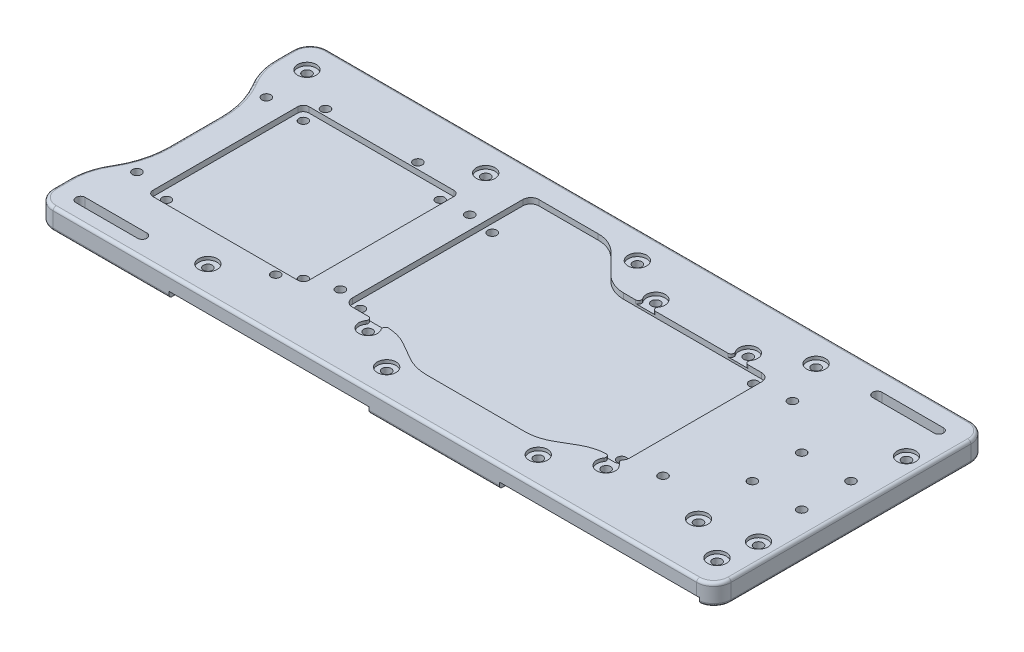
from build123d import *

# Parameters (mm, degrees)
SKETCH_1_W           = 210
SKETCH_1_H           = 89
EXTRUDE_1_DEPTH      = 6.8
SKETCH_9_W           = 89
SKETCH_9_H           = 6.8
EXTRUDE_2_DEPTH      = 5
SKETCH_10_W          = 89
SKETCH_10_H          = 6.8
EXTRUDE_3_DEPTH      = 5
CUT_EXTRUDE_4_DEPTH  = 119.854911552
FILLET_1_R           = 20
FILLET_2_R           = 28
FILLET_3_R           = 5.6
SKETCH_13_W          = 50.6
SKETCH_13_H          = 50.6
CUT_EXTRUDE_5_DEPTH  = 1.8
FILLET_4_R           = 1.8
SKETCH_14_R          = 1.425
CUT_EXTRUDE_6_DEPTH  = 3
SKETCH_15_W          = 90
SKETCH_15_H          = 48
CUT_EXTRUDE_7_DEPTH  = 1.8
FILLET_5_R           = 2.6
SKETCH_16_R          = 1.45
CUT_EXTRUDE_8_DEPTH  = 3
SKETCH_18_R          = 1.45
CUT_EXTRUDE_9_DEPTH  = 119.854911552
SKETCH_19_R          = 3.025
CUT_EXTRUDE_10_DEPTH = 1.04
FILLET_6_R           = 1
CUT_EXTRUDE_12_DEPTH = 1.8
FILLET_7_R           = 2.6
FILLET_8_R           = 10
FILLET_9_R           = 15
SKETCH_23_R          = 1.45
CUT_EXTRUDE_14_DEPTH = 6.8
SKETCH_26_R          = 1.45
CUT_EXTRUDE_15_DEPTH = 6.8
CUT_EXTRUDE_16_DEPTH = 2
SKETCH_28_R          = 3.025
CUT_EXTRUDE_17_DEPTH = 1.04
FILLET_10_R          = 1
CUT_EXTRUDE_20_DEPTH = 1.04
FILLET_11_R          = 1
CUT_EXTRUDE_START    = -2
CUT_EXTRUDE_21_DEPTH = 2


# Read off the part's stored shape, not the designer's step: 切除-拉伸21
with BuildPart() as part:
    # 草图1 → 凸台-拉伸1 (new body)
    with BuildSketch(Plane(origin=(0, 0, 0), x_dir=(1, 0, 0), z_dir=(0, 1, 0))):
        Rectangle(SKETCH_1_W, SKETCH_1_H)
    extrude(amount=EXTRUDE_1_DEPTH)

    # 草图9 → 凸台-拉伸2 (add)
    with BuildSketch(Plane.ZY.offset(105)):
        with Locations((0, 3.4)):
            Rectangle(SKETCH_9_W, SKETCH_9_H)
    extrude(amount=EXTRUDE_2_DEPTH)

    # 草图10 → 凸台-拉伸3 (add)
    with BuildSketch(Plane(origin=(105, 0, 0), x_dir=(0, 0, -1), z_dir=(1, 0, 0))):
        with Locations((0, 3.4)):
            Rectangle(SKETCH_10_W, SKETCH_10_H)
    extrude(amount=EXTRUDE_3_DEPTH)

    # 草图11 → 切除-拉伸4 (cut, through all)
    with BuildSketch(Plane(origin=(0, 6.8, 0), x_dir=(1, 0, 0), z_dir=(0, 1, 0))):
        Polygon((-110, 0), (-110, 28), (-103, 15.875644347), (-103, -15.875644347), (-110, -28), align=None)
    extrude(amount=-CUT_EXTRUDE_4_DEPTH, mode=Mode.SUBTRACT)

    # 圆角1
    fillet_1_edges = [part.edges().sort_by_distance(p)[0] for p in [
        (-110, 3.4, 28),
        (-110, 3.4, -28),
    ]]
    fillet(fillet_1_edges, radius=FILLET_1_R)

    # 圆角2
    fillet_2_edges = [part.edges().sort_by_distance(p)[0] for p in [
        (-103, 3.4, -15.875644347),
        (-103, 3.4, 15.875644347),
    ]]
    fillet(fillet_2_edges, radius=FILLET_2_R)

    # 圆角3
    fillet_3_edges = [part.edges().sort_by_distance(p)[0] for p in [
        (-110, 3.4, -44.5),
        (-110, 3.4, 44.5),
        (110, 3.4, 44.5),
        (110, 3.4, -44.5),
    ]]
    fillet(fillet_3_edges, radius=FILLET_3_R)

    # 草图13 → 切除-拉伸5 (cut)
    with BuildSketch(Plane(origin=(0, 6.8, 0), x_dir=(1, 0, 0), z_dir=(0, 1, 0))):
        with Locations((-67.7, 0)):
            Rectangle(SKETCH_13_W, SKETCH_13_H)
    extrude(amount=-CUT_EXTRUDE_5_DEPTH, mode=Mode.SUBTRACT)

    # 圆角4
    fillet_4_edges = [part.edges().sort_by_distance(p)[0] for p in [
        (-42.4, 5.9, -25.3),
        (-42.4, 5.9, 25.3),
        (-93, 5.9, 25.3),
        (-93, 5.9, -25.3),
    ]]
    fillet(fillet_4_edges, radius=FILLET_4_R)

    # 草图14 → 切除-拉伸6 (cut)
    with BuildSketch(Plane(origin=(0, 5, 0), x_dir=(1, 0, 0), z_dir=(0, 1, 0))):
        with Locations(Location((-89.9, 22.2, 0), (0, 0, 270))):
            Circle(SKETCH_14_R)
        with Locations(Location((-45.5, 22.2, 0), (0, 0, 90))):
            Circle(SKETCH_14_R)
        with Locations(Location((-45.5, -22.2, 0), (0, 0, 270))):
            Circle(SKETCH_14_R)
        with Locations(Location((-89.9, -22.2, 0), (0, 0, 90))):
            Circle(SKETCH_14_R)
    extrude(amount=-CUT_EXTRUDE_6_DEPTH, mode=Mode.SUBTRACT)

    # 草图15 → 切除-拉伸7 (cut)
    with BuildSketch(Plane(origin=(0, 6.8, 0), x_dir=(1, 0, 0), z_dir=(0, 1, 0))):
        with Locations((14.6, 0)):
            Rectangle(SKETCH_15_W, SKETCH_15_H)
    extrude(amount=-CUT_EXTRUDE_7_DEPTH, mode=Mode.SUBTRACT)

    # 圆角5
    fillet_5_edges = [part.edges().sort_by_distance(p)[0] for p in [
        (59.6, 5.9, -24),
        (59.6, 5.9, 24),
        (-30.4, 5.9, 24),
        (-30.4, 5.9, -24),
    ]]
    fillet(fillet_5_edges, radius=FILLET_5_R)

    # 草图16 → 切除-拉伸8 (cut)
    with BuildSketch(Plane(origin=(0, 5, 0), x_dir=(1, 0, 0), z_dir=(0, 1, 0))):
        with Locations(Location((-27.8, -21.4, 0), (0, 0, 270))):
            Circle(SKETCH_16_R)
        with Locations(Location((-27.8, 21.4, 0), (0, 0, 90))):
            Circle(SKETCH_16_R)
        with Locations(Location((57, -21.4, 0), (0, 0, 90))):
            Circle(SKETCH_16_R)
        with Locations(Location((57, 21.4, 0), (0, 0, 270))):
            Circle(SKETCH_16_R)
    extrude(amount=-CUT_EXTRUDE_8_DEPTH, mode=Mode.SUBTRACT)

    # 草图18 → 切除-拉伸9 (cut, through all)
    with BuildSketch(Plane(origin=(0, 6.8, 0), x_dir=(1, 0, 0), z_dir=(0, 1, 0))):
        with Locations(Location((102, 8, 0), (0, 0, 270))):
            Circle(SKETCH_18_R)
        with Locations(Location((86, 8, 0), (0, 0, 270))):
            Circle(SKETCH_18_R)
        with Locations(Location((70, 21, 0), (0, 0, 270))):
            Circle(SKETCH_18_R)
        with Locations(Location((102, -8, 0), (0, 0, 90))):
            Circle(SKETCH_18_R)
        with Locations(Location((86, -8, 0), (0, 0, 90))):
            Circle(SKETCH_18_R)
        with Locations(Location((70, -21, 0), (0, 0, 90))):
            Circle(SKETCH_18_R)
        with Locations(Location((104, 24, 0), (0, 0, 270))):
            Circle(SKETCH_18_R)
        with Locations(Location((104, -24, 0), (0, 0, 90))):
            Circle(SKETCH_18_R)
        with BuildLine():
            Line((102, 35), (82, 35))
            ThreePointArc((82, 35), (80.5, 36.5), (82, 38))
            Line((82, 38), (102, 38))
            ThreePointArc((102, 38), (103.5, 36.5), (102, 35))
        make_face()
        with BuildLine():
            Line((-102, -36.5), (-82, -36.5))
            ThreePointArc((-82, -36.5), (-80.5, -38), (-82, -39.5))
            Line((-82, -39.5), (-102, -39.5))
            ThreePointArc((-102, -39.5), (-103.5, -38), (-102, -36.5))
        make_face()
    extrude(amount=-CUT_EXTRUDE_9_DEPTH, mode=Mode.SUBTRACT)

    # 草图19 → 切除-拉伸10 (cut)
    with BuildSketch(Plane(origin=(0, 6.8, 0), x_dir=(1, 0, 0), z_dir=(0, 1, 0))):
        with Locations(Location((104, 24, 0), (0, 0, 270))):
            Circle(SKETCH_19_R)
        with Locations(Location((104, -24, 0), (0, 0, 270))):
            Circle(SKETCH_19_R)
    extrude(amount=-CUT_EXTRUDE_10_DEPTH, mode=Mode.SUBTRACT)

    # 圆角6
    fillet_6_edges = [part.edges().sort_by_distance(p)[0] for p in [
        (-107.035898385, 0, 22.866025404),
        (-110, 0, 36.129491924),
        (-109.318516526, 0, -28.182602947),
        (-109.318516526, 0, 28.182602947),
        (-103, 0, 0),
        (-107.035898385, 0, -22.866025404),
        (-103.954076864, 0, 15.620000222),
        (-103.954076864, 0, -15.620000222),
        (110, 0, 0),
        (0, 0, -44.5),
        (-110, 0, -36.129491924),
        (0, 0, 44.5),
        (-108.359797975, 0, 42.859797975),
        (-108.359797975, 0, -42.859797975),
        (108.359797975, 0, 42.859797975),
        (108.359797975, 0, -42.859797975),
    ]]
    fillet(fillet_6_edges, radius=FILLET_6_R)

    # 草图21 → 切除-拉伸12 (cut)
    with BuildSketch(Plane(origin=(0, 6.8, 0), x_dir=(1, 0, 0), z_dir=(0, 1, 0))):
        Polygon((-30.4, 21.4), (-30.4, 36.5), (-4.4, 36.5), (8.1, 24), (8.1, 21.4), align=None)
        Polygon((-12.75, -24), (-0.625644347, -31), (39.125644347, -31), (51.25, -24), align=None)
    extrude(amount=-CUT_EXTRUDE_12_DEPTH, mode=Mode.SUBTRACT)

    # 圆角7
    fillet_7_edges = [part.edges().sort_by_distance(p)[0] for p in [
        (-30.4, 5.9, -36.5),
    ]]
    fillet(fillet_7_edges, radius=FILLET_7_R)

    # 圆角8
    fillet_8_edges = [part.edges().sort_by_distance(p)[0] for p in [
        (-4.4, 5.9, -36.5),
        (8.1, 5.9, -24),
    ]]
    fillet(fillet_8_edges, radius=FILLET_8_R)

    # 圆角9
    fillet_9_edges = [part.edges().sort_by_distance(p)[0] for p in [
        (-12.75, 5.9, 24),
        (51.25, 5.9, 24),
        (39.125644347, 5.9, 31),
        (-0.625644347, 5.9, 31),
    ]]
    fillet(fillet_9_edges, radius=FILLET_9_R)

    # 草图23 → 切除-拉伸14 (cut)
    with BuildSketch(Plane(origin=(0, 6.8, 0), x_dir=(1, 0, 0), z_dir=(0, 1, 0))):
        with Locations(Location((-100.7, 21, 0), (0, 0, 270))):
            Circle(SKETCH_23_R)
        with Locations(Location((-34.7, 21, 0), (0, 0, 90))):
            Circle(SKETCH_23_R)
        with Locations(Location((-34.7, -21, 0), (0, 0, 270))):
            Circle(SKETCH_23_R)
        with Locations(Location((-100.7, -21, 0), (0, 0, 90))):
            Circle(SKETCH_23_R)
    extrude(amount=-CUT_EXTRUDE_14_DEPTH, mode=Mode.SUBTRACT)

    # 草图26 → 切除-拉伸15 (cut)
    with BuildSketch(Plane.XZ):
        with Locations(Location((-101.85, -35.322234231, 0), (0, 0, 270))):
            Circle(SKETCH_26_R)
        with Locations(Location((-87.85, -27.322234231, 0), (0, 0, 270))):
            Circle(SKETCH_26_R)
        with Locations(Location((-57.85, -27.322234231, 0), (0, 0, 270))):
            Circle(SKETCH_26_R)
        with Locations(Location((-43.85, -35.322234231, 0), (0, 0, 270))):
            Circle(SKETCH_26_R)
        with Locations(Location((5.35, -35.322234231, 0), (0, 0, 270))):
            Circle(SKETCH_26_R)
        with Locations(Location((19.35, -27.322234231, 0), (0, 0, 270))):
            Circle(SKETCH_26_R)
        with Locations(Location((49.35, -27.322234231, 0), (0, 0, 270))):
            Circle(SKETCH_26_R)
        with Locations(Location((63.35, -35.322234231, 0), (0, 0, 270))):
            Circle(SKETCH_26_R)
        with Locations(Location((101.85, 35.322234231, 0), (0, 0, 270))):
            Circle(SKETCH_26_R)
        with Locations(Location((87.85, 27.322234231, 0), (0, 0, 270))):
            Circle(SKETCH_26_R)
        with Locations(Location((57.85, 27.322234231, 0), (0, 0, 270))):
            Circle(SKETCH_26_R)
        with Locations(Location((43.85, 35.322234231, 0), (0, 0, 270))):
            Circle(SKETCH_26_R)
        with Locations(Location((-5.35, 35.322234231, 0), (0, 0, 270))):
            Circle(SKETCH_26_R)
        with Locations(Location((-19.35, 27.322234231, 0), (0, 0, 270))):
            Circle(SKETCH_26_R)
        with Locations(Location((-49.35, 27.322234231, 0), (0, 0, 270))):
            Circle(SKETCH_26_R)
        with Locations(Location((-63.35, 35.322234231, 0), (0, 0, 270))):
            Circle(SKETCH_26_R)
    extrude(amount=-CUT_EXTRUDE_15_DEPTH, mode=Mode.SUBTRACT)

    # 草图27 → 切除-拉伸16 (cut)
    with BuildSketch(Plane.XZ):
        with BuildLine():
            Line((-66.5, 44.5), (-66.5, 35.822234231))
            ThreePointArc((-66.5, 35.822234231), (-62.985281374, 27.336952857), (-54.5, 23.822234231))
            Line((-54.5, 23.822234231), (-14.2, 23.822234231))
            ThreePointArc((-14.2, 23.822234231), (-5.714718626, 27.336952857), (-2.2, 35.822234231))
            Line((-2.2, 35.822234231), (-2.20241857, 44.5))
            Line((-2.20241857, 44.5), (-66.5, 44.5))
        make_face()
        with BuildLine():
            Line((40.7, 44.5), (105, 44.5))
            Line((105, 44.5), (105, 35.822234231))
            ThreePointArc((105, 35.822234231), (101.485281374, 27.336952857), (93, 23.822234231))
            Line((93, 23.822234231), (52.7, 23.822234231))
            ThreePointArc((52.7, 23.822234231), (44.214718626, 27.336952857), (40.7, 35.822234231))
            Line((40.7, 35.822234231), (40.7, 44.5))
        make_face()
        with BuildLine():
            Line((66.5, -44.5), (66.5, -35.822234231))
            ThreePointArc((66.5, -35.822234231), (62.985281374, -27.336952857), (54.5, -23.822234231))
            Line((54.5, -23.822234231), (14.2, -23.822234231))
            ThreePointArc((14.2, -23.822234231), (5.714718626, -27.336952857), (2.2, -35.822234231))
            Line((2.2, -35.822234231), (2.202418571, -44.5))
            Line((2.202418571, -44.5), (66.5, -44.5))
        make_face()
        with BuildLine():
            Line((-105, -35.822234231), (-104.997581429, -44.5))
            Line((-104.997581429, -44.5), (-40.7, -44.5))
            Line((-40.7, -44.5), (-40.7, -35.822234231))
            ThreePointArc((-40.7, -35.822234231), (-44.214718626, -27.336952857), (-52.7, -23.822234231))
            Line((-52.7, -23.822234231), (-93, -23.822234231))
            ThreePointArc((-93, -23.822234231), (-101.485281374, -27.336952857), (-105, -35.822234231))
        make_face()
    extrude(amount=-CUT_EXTRUDE_16_DEPTH, mode=Mode.SUBTRACT)

    # 草图28 → 切除-拉伸17 (cut)
    with BuildSketch(Plane(origin=(0, 6.8, 0), x_dir=(1, 0, 0), z_dir=(0, 1, 0))):
        with Locations(Location((-63.35, -35.322234231, 0), (0, 0, 270))):
            Circle(SKETCH_28_R)
        with Locations(Location((-19.35, -27.322234231, 0), (0, 0, 270))):
            Circle(SKETCH_28_R)
        with Locations(Location((-5.35, -35.322234231, 0), (0, 0, 270))):
            Circle(SKETCH_28_R)
        with Locations(Location((43.85, -35.322234231, 0), (0, 0, 270))):
            Circle(SKETCH_28_R)
        with Locations(Location((57.85, -27.322234231, 0), (0, 0, 270))):
            Circle(SKETCH_28_R)
        with Locations(Location((87.85, -27.322234231, 0), (0, 0, 270))):
            Circle(SKETCH_28_R)
        with Locations(Location((101.85, -35.322234231, 0), (0, 0, 270))):
            Circle(SKETCH_28_R)
        with Locations(Location((63.35, 35.322234231, 0), (0, 0, 270))):
            Circle(SKETCH_28_R)
        with Locations(Location((49.35, 27.322234231, 0), (0, 0, 270))):
            Circle(SKETCH_28_R)
        with Locations(Location((19.35, 27.322234231, 0), (0, 0, 270))):
            Circle(SKETCH_28_R)
        with Locations(Location((5.35, 35.322234231, 0), (0, 0, 270))):
            Circle(SKETCH_28_R)
        with Locations(Location((-43.85, 35.322234231, 0), (0, 0, 270))):
            Circle(SKETCH_28_R)
        with Locations(Location((-101.85, 35.322234231, 0), (0, 0, 270))):
            Circle(SKETCH_28_R)
    extrude(amount=-CUT_EXTRUDE_17_DEPTH, mode=Mode.SUBTRACT)

    # 圆角10
    fillet_10_edges = [part.edges().sort_by_distance(p)[0] for p in [
        (-107.035898385, 6.8, 22.866025404),
        (-110, 6.8, -36.129491924),
        (-109.318516526, 6.8, -28.182602947),
        (-109.318516526, 6.8, 28.182602947),
        (-103, 6.8, 0),
        (-107.035898385, 6.8, -22.866025404),
        (-103.954076864, 6.8, 15.620000222),
        (-103.954076864, 6.8, -15.620000222),
        (110, 6.8, 0),
        (-110, 6.8, 36.129491924),
        (0, 6.8, 44.5),
        (0, 6.8, -44.5),
        (-108.359797975, 6.8, 42.859797975),
        (-108.359797975, 6.8, -42.859797975),
        (108.359797975, 6.8, 42.859797975),
        (108.359797975, 6.8, -42.859797975),
    ]]
    fillet(fillet_10_edges, radius=FILLET_10_R)

    # 草图32 → 切除-拉伸20 (cut)
    with BuildSketch(Plane(origin=(0, 6.8, 0), x_dir=(1, 0, 0), z_dir=(0, 1, 0))):
        with BuildLine():
            Line((-21.488998013, -25.183236218), (-20.305761795, -24))
            Line((-20.305761795, -24), (-18.394238205, -24))
            Line((-18.394238205, -24), (-17.211001987, -25.183236218))
            ThreePointArc((-17.211001987, -25.183236218), (-19.35, -30.347234231), (-21.488998013, -25.183236218))
        make_face()
        with BuildLine():
            Line((55.711001987, -25.183236218), (57.1721109, -23.722127305))
            Line((57.1721109, -23.722127305), (57.843769498, -23.038007703))
            Line((57.843769498, -23.038007703), (59.988998013, -25.183236218))
            ThreePointArc((59.988998013, -25.183236218), (57.85, -30.347234231), (55.711001987, -25.183236218))
        make_face()
        with BuildLine():
            Line((47.211001987, 25.183236218), (48.686058032, 23.708180173))
            Line((48.686058032, 23.708180173), (49.976374788, 23.670612993))
            Line((49.976374788, 23.670612993), (51.488998013, 25.183236218))
            ThreePointArc((51.488998013, 25.183236218), (49.35, 30.347234231), (47.211001987, 25.183236218))
        make_face()
        with BuildLine():
            Line((17.211001987, 25.183236218), (18.394238205, 24))
            Line((18.394238205, 24), (20.305761795, 24))
            Line((20.305761795, 24), (21.488998013, 25.183236218))
            ThreePointArc((21.488998013, 25.183236218), (19.35, 30.347234231), (17.211001987, 25.183236218))
        make_face()
    extrude(amount=-CUT_EXTRUDE_20_DEPTH, mode=Mode.SUBTRACT)

    # 圆角11
    # the kernel refuses this fillet: 1 mm, written as the material it takes off along each edge
    with BuildSketch(Plane(origin=(18.394238205, 12.629420389, -24), x_dir=(-0.6927973692834478, 0, -0.7211323076342745), z_dir=(0, -1, 0)), Plane(origin=(50.305761795, 5.76, -24), x_dir=(0.6927973692834356, 0, -0.7211323076342864), z_dir=(0, 1, 0)), Plane(origin=(48.394238205, 12.629420389, -24), x_dir=(-0.6927973692834373, 0, -0.7211323076342848), z_dir=(0, -1, 0))) as fillet_11_piece_1:
        with BuildLine():
            CenterArc((2.336575152, -0.988715982), FILLET_11_R, 98.615465609, 125.236489242)
            Line((1.615442844, -1.681513351), (1.543329613, -1.750793088))
            Line((1.543329613, -1.750793088), (-0.072113231, -0.069279737))
            Line((-0.072113231, -0.069279737), (0.002003583, 0.099979926))
            ThreePointArc((0.002003583, 0.099979926), (1.675016386, 0.066453001), (2.1717927, 0.098871598))
            Line((2.1717927, 0.098871598), (2.186772923, 0))
        make_face()
    extrude(amount=6.869420389, mode=Mode.SUBTRACT)
    with BuildSketch(Plane(origin=(20.305761795, 12.629420389, -24), x_dir=(0.6927973692834504, 0, -0.7211323076342722), z_dir=(0, -1, 0))) as fillet_11_piece_2:
        with BuildLine():
            CenterArc((2.336575152, 0.988715982), FILLET_11_R, 136.148045149, 125.236489242)
            Line((1.615442844, 1.681513351), (1.543329613, 1.750793088))
            Line((1.543329613, 1.750793088), (-0.072113231, 0.069279737))
            Line((-0.072113231, 0.069279737), (0.002003583, -0.099979926))
            ThreePointArc((0.002003583, -0.099979926), (1.675016386, -0.066453001), (2.1717927, -0.098871598))
            Line((2.1717927, -0.098871598), (2.186772923, 0))
        make_face()
    extrude(amount=6.869420389, mode=Mode.SUBTRACT)
    with BuildSketch(Plane(origin=(56.894238205, 12.790656841, 24), x_dir=(-0.9999657339279648, 0, 0.008278343427679356), z_dir=(0, -1, 0))) as fillet_11_piece_3:
        with BuildLine():
            CenterArc((2.353119873, -0.999068913), FILLET_11_R, 87.527328548, 127.861441179)
            Line((1.537878551, -1.578190305), (1.456354419, -1.636102444))
            ThreePointArc((1.456354419, -1.636102444), (1.122868021, -1.24469406), (-0.070122888, -0.071293622))
            Line((-0.070122888, -0.071293622), (-0.000827834, 0.099996573))
            ThreePointArc((-0.000827834, 0.099996573), (1.624116802, 0.113448884), (2.400577023, 0.099906891))
            Line((2.400577023, 0.099906891), (2.396262736, 0))
        make_face()
    extrude(amount=7.030656841, mode=Mode.SUBTRACT)
    with BuildSketch(Plane(origin=(58.3979565, 9.386469297, 23.592194705), x_dir=(0.7071067811865543, 0, 0.7071067811865407), z_dir=(0, -1, 0))) as fillet_11_piece_4:
        with BuildLine():
            CenterArc((1.034587719, -1), FILLET_11_R, 90, 83.005465614)
            ThreePointArc((0.042029946, -0.878225339), (0.058407361, -0.437323152), (0, 0))
            Line((0, 0), (1.034587719, 0))
        make_face()
    extrude(amount=3.626469297, mode=Mode.SUBTRACT)
    with BuildSketch(Plane(origin=(-18.394238205, 12.790656841, 24), x_dir=(0.6919479127908168, 0, 0.7219474260529172), z_dir=(0, -1, 0))) as fillet_11_piece_5:
        with BuildLine():
            CenterArc((2.357771746, -0.988040598), FILLET_11_R, 98.870051352, 127.861441179)
            Line((1.672353516, -1.716190205), (1.603811693, -1.789005166))
            ThreePointArc((1.603811693, -1.789005166), (1.052220836, -1.242359589), (-0.072194743, -0.069194791))
            Line((-0.072194743, -0.069194791), (0.002121286, 0.099977498))
            ThreePointArc((0.002121286, 0.099977498), (1.675093459, 0.064480988), (2.188158394, 0.09880406))
            Line((2.188158394, 0.09880406), (2.20357779, 0))
        make_face()
    extrude(amount=7.030656841, mode=Mode.SUBTRACT)
    with BuildSketch(Plane(origin=(-20.305761795, 12.629420389, 24), x_dir=(-1, 0, 0), z_dir=(0, -1, 0))) as fillet_11_piece_6:
        with BuildLine():
            CenterArc((2.331768156, -1), FILLET_11_R, 90, 125.236489241)
            Line((1.514990528, -1.576952604), (1.433312765, -1.634647864))
            ThreePointArc((1.433312765, -1.634647864), (1.11252554, -1.253946896), (-0.070710678, -0.070710678))
            Line((-0.070710678, -0.070710678), (0, 0.1))
            Line((0, 0.1), (2.331768156, 0.1))
            Line((2.331768156, 0.1), (2.331768156, 0))
        make_face()
    extrude(amount=6.869420389, mode=Mode.SUBTRACT)

    # 切除-拉伸21 outline → 切除-拉伸21 (cut)
    with BuildSketch(Plane.XZ.offset(CUT_EXTRUDE_START)):
        with BuildLine():
            Line((40.7, 44.5), (40.4, 44.5))
            Line((40.4, 44.5), (40.4, 35.822234231))
            ThreePointArc((40.4, 35.822234231), (44.002586591, 27.124820822), (52.7, 23.522234231))
            Line((52.7, 23.522234231), (93, 23.522234231))
            ThreePointArc((93, 23.522234231), (101.697413408, 27.124820822), (105.3, 35.822234231))
            Line((105.3, 35.822234231), (105.3, 44.427205442))
            ThreePointArc((105.3, 44.427205442), (105.150274121, 44.449512478), (105, 44.467764363))
            Line((105, 44.467764363), (105, 35.822234231))
            ThreePointArc((105, 35.822234231), (101.485281374, 27.336952857), (93, 23.822234231))
            Line((93, 23.822234231), (52.7, 23.822234231))
            ThreePointArc((52.7, 23.822234231), (44.214718626, 27.336952857), (40.7, 35.822234231))
            Line((40.7, 35.822234231), (40.7, 44.5))
        make_face()
        with BuildLine():
            Line((-66.8, 44.5), (-66.8, 35.822234231))
            ThreePointArc((-66.8, 35.822234231), (-63.197413408, 27.124820822), (-54.5, 23.522234231))
            Line((-54.5, 23.522234231), (-14.2, 23.522234234))
            ThreePointArc((-14.2, 23.522234234), (-5.502571812, 27.124835606), (-1.900000003, 35.822276038))
            Line((-1.900000003, 35.822276038), (-1.902139873, 43.500083613))
            Line((-1.902139873, 43.500083613), (-1.902139873, 44.5))
            Line((-1.902139873, 44.5), (-2.20241857, 44.5))
            Line((-2.20241857, 44.5), (-2.2, 35.822234231))
            ThreePointArc((-2.2, 35.822234231), (-5.714718626, 27.336952857), (-14.2, 23.822234231))
            Line((-14.2, 23.822234231), (-54.5, 23.822234231))
            ThreePointArc((-54.5, 23.822234231), (-62.985281374, 27.336952857), (-66.5, 35.822234231))
            Line((-66.5, 35.822234231), (-66.5, 44.5))
            Line((-66.5, 44.5), (-66.8, 44.5))
        make_face()
        with BuildLine():
            Line((-40.7, -44.5), (-40.4, -44.5))
            Line((-40.4, -44.5), (-40.4, -35.822234231))
            ThreePointArc((-40.4, -35.822234231), (-44.002586591, -27.124820822), (-52.7, -23.522234231))
            Line((-52.7, -23.522234231), (-93, -23.522234234))
            ThreePointArc((-93, -23.522234234), (-101.697428188, -27.124835606), (-105.299999997, -35.822276038))
            Line((-105.299999997, -35.822276038), (-105.297871002, -43.461064894))
            Line((-105.297871002, -43.461064894), (-105.297871002, -44.427551688))
            ThreePointArc((-105.297871002, -44.427551688), (-105.148004445, -44.449818858), (-104.997590342, -44.468023508))
            Line((-104.997590342, -44.468023508), (-105, -35.822234231))
            ThreePointArc((-105, -35.822234231), (-101.485281374, -27.336952857), (-93, -23.822234231))
            Line((-93, -23.822234231), (-52.7, -23.822234231))
            ThreePointArc((-52.7, -23.822234231), (-44.214718626, -27.336952857), (-40.7, -35.822234231))
            Line((-40.7, -35.822234231), (-40.7, -44.5))
        make_face()
        with BuildLine():
            Line((66.8, -44.5), (66.8, -35.822234231))
            ThreePointArc((66.8, -35.822234231), (63.197413408, -27.124820822), (54.5, -23.522234231))
            Line((54.5, -23.522234231), (14.2, -23.522234234))
            ThreePointArc((14.2, -23.522234234), (5.502571812, -27.124835606), (1.900000003, -35.822276038))
            Line((1.900000003, -35.822276038), (1.902139873, -43.500083613))
            Line((1.902139873, -43.500083613), (1.902139873, -44.5))
            Line((1.902139873, -44.5), (2.202418571, -44.5))
            Line((2.202418571, -44.5), (2.2, -35.822234231))
            ThreePointArc((2.2, -35.822234231), (5.714718626, -27.336952857), (14.2, -23.822234231))
            Line((14.2, -23.822234231), (54.5, -23.822234231))
            ThreePointArc((54.5, -23.822234231), (62.985281374, -27.336952857), (66.5, -35.822234231))
            Line((66.5, -35.822234231), (66.5, -44.5))
            Line((66.5, -44.5), (66.8, -44.5))
        make_face()
    extrude(amount=CUT_EXTRUDE_21_DEPTH, mode=Mode.SUBTRACT)


solid = part.part
